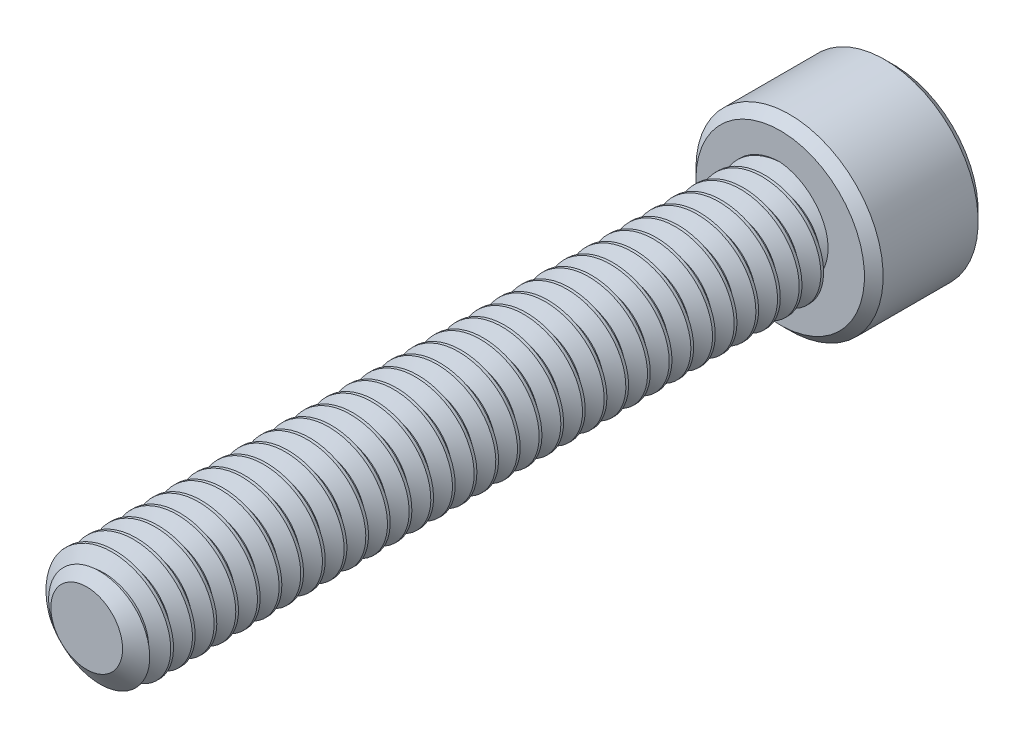
from build123d import *

# Parameters (mm, degrees)
SKETCH1_R          = 2.0828
EXTRUDE1_DEPTH     = 25.4
CUT_SWEEP1_PITCH   = 0.79375
SKETCH6_R          = 3.429
EXTRUDE2_DEPTH     = 4.1656
CUT_EXTRUDE1_DEPTH = 2.67890625
CHAMFER1_SIZE      = 0.3429


with BuildPart() as part:
    # Sketch1 → Extrude1 (new body)
    with BuildSketch(Plane.XY):
        Circle(SKETCH1_R)
    extrude(amount=-EXTRUDE1_DEPTH)

    # Cut-Sweep1: the profile of Sketch3 profile screwed along a right-hand helix of 33 turns, 6 arcs to a turn; built about Z, then put on its axis
    cut_sweep1_z = Axis((0, 0, 0), (0, 0, 1))
    cut_sweep1_corners = [(2.0831, 0, -0.694704455), (1.567244252, 0, -0.396875), (1.567244252, 0, -0.29765625), (2.0831, 0, 0.000173205)]
    with BuildLine(mode=Mode.PRIVATE) as cut_sweep1_profile:
        Line(cut_sweep1_corners[0], cut_sweep1_corners[1])
        Line(cut_sweep1_corners[1], cut_sweep1_corners[2])
        Line(cut_sweep1_corners[2], cut_sweep1_corners[3])
        Line(cut_sweep1_corners[3], cut_sweep1_corners[0])
    cut_sweep1_cap = Face(cut_sweep1_profile.wire())
    cut_sweep1_turn_angles = [0, 30, 60, 90, 120, 150, 180, 210, 240, 270, 300, 330, 360]
    cut_sweep1_turn_weights = [1, 0.8660254037844387, 1, 0.8660254037844387, 1, 0.8660254037844387, 1, 0.8660254037844387, 1, 0.8660254037844387, 1, 0.8660254037844387, 1]
    cut_sweep1_turn_rails = [Edge.make_bspline([Vector(p[0], p[1], 0).rotate(cut_sweep1_z, cut_sweep1_turn_angles[k]) / cut_sweep1_turn_weights[k] + Vector(0, 0, p[2] + CUT_SWEEP1_PITCH * cut_sweep1_turn_angles[k] / 360) for k in range(13)], [0, 0, 0, 1, 1, 2, 2, 3, 3, 4, 4, 5, 5, 6, 6, 6], 2, cut_sweep1_turn_weights) for p in cut_sweep1_corners]
    cut_sweep1_turn_sides = [Face.make_surface_from_curves(cut_sweep1_turn_rails[p[0]], cut_sweep1_turn_rails[p[1]]) for p in [(0, 1), (1, 2), (2, 3), (3, 0)]]
    cut_sweep1 = Plane(origin=(0, 0, 0), x_dir=(0, 1, 0), z_dir=(0, 0, -1)) * Solid(Shell([*[p.moved(Location((0, 0, CUT_SWEEP1_PITCH * i))) for i in range(33) for p in cut_sweep1_turn_sides], cut_sweep1_cap, cut_sweep1_cap.rotate(cut_sweep1_z, 11880).moved(Location((0, 0, CUT_SWEEP1_PITCH * 11880 / 360)))]))
    add(cut_sweep1, mode=Mode.SUBTRACT)

    # Sketch4 → Cut-Revolve1 (revolve, cut)
    with BuildSketch(Plane(origin=(0, 0, 0), x_dir=(0, 0, -1), z_dir=(1, 0, 0)), mode=Mode.PRIVATE) as cut_revolve1_sk:
        Polygon((0.538848736, 2.0828), (0, 1.313244252), (0, 2.0828), align=None)
    revolve(cut_revolve1_sk.sketch.rotate(Axis((0, 0, 0), (0, 0, -1)), 261.048315518), axis=Axis((0, 0, 0), (0, 0, -1)), mode=Mode.SUBTRACT)

    # Sketch6 → Extrude2 (add)
    with BuildSketch(Plane(origin=(0, 0, -25.4), x_dir=(-1, 0, 0), z_dir=(0, 0, -1))):
        Circle(SKETCH6_R)
    extrude(amount=EXTRUDE2_DEPTH)

    # Sketch7 → Cut-Extrude1 (cut)
    with BuildSketch(Plane(origin=(0, 0, -29.5656), x_dir=(-1, 0, 0), z_dir=(0, 0, -1))):
        Polygon((0, 2.062222993), (-1.7859375, 1.031111496), (-1.7859375, -1.031111496), (0, -2.062222993), (1.7859375, -1.031111496), (1.7859375, 1.031111496), align=None)
    extrude(amount=-CUT_EXTRUDE1_DEPTH, mode=Mode.SUBTRACT)

    # Cut-Extrude2 cone 1 section (through the dimple's axis) → Cut-Extrude2 (revolve, cut)
    with BuildSketch(Plane(origin=(0, 0, -29.5656), x_dir=(0, 1, 0), z_dir=(1, 0, 0))):
        Polygon((0, 0), (2.062222993, 0), (0, 2.062222993), align=None)
    revolve(axis=Axis((0, 0, -29.5656), (0, 0, 1)), mode=Mode.SUBTRACT)

    # Chamfer1
    chamfer1_edges = [part.edges().sort_by_distance(p)[0] for p in [
        (3.429, 0, -25.4),
        (3.429, 0, -29.5656),
    ]]
    chamfer(chamfer1_edges, length=CHAMFER1_SIZE)


solid = part.part
